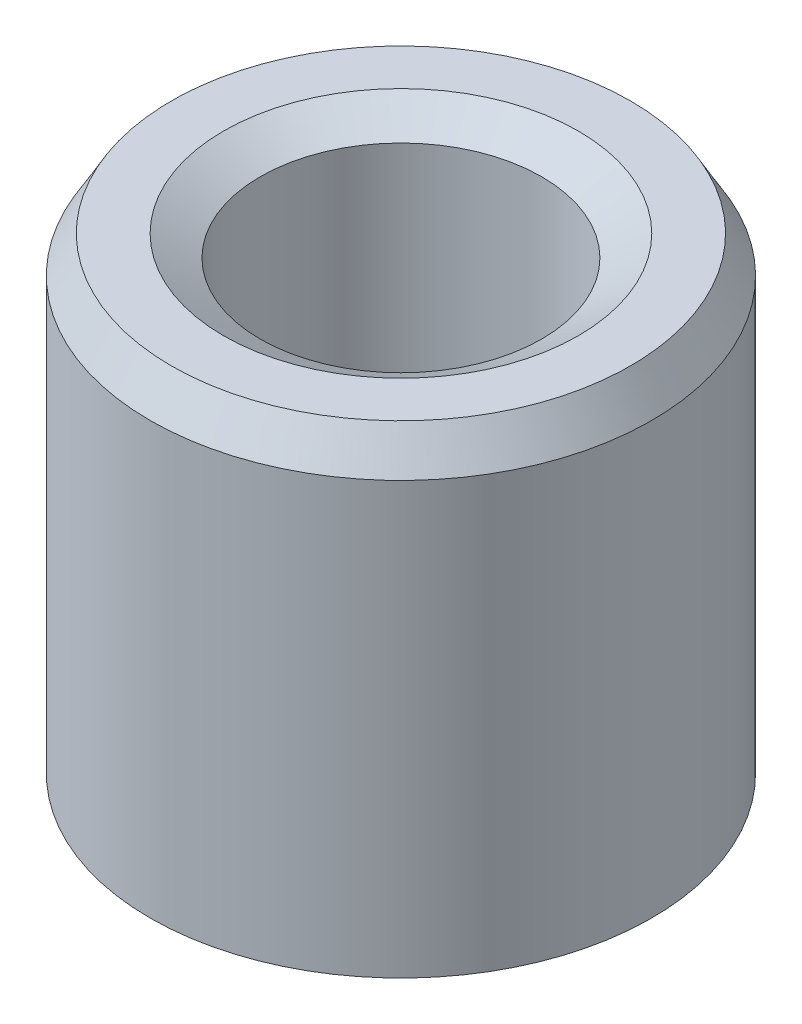
from build123d import *
from OCP.BRepFilletAPI import BRepFilletAPI_MakeChamfer

# Parameters (mm, degrees)
SKETCH1_R           = 5
BOSS_EXTRUDE1_DEPTH = 9.746797896
SKETCH2_R           = 2.80569337
CUT_EXTRUDE1_DEPTH  = 13.041597453
CHAMFER1_SIZE       = 0.731059209
CHAMFER1_SIZE2      = 0.4230348


with BuildPart() as part:
    # Sketch1 → Boss-Extrude1 (new body)
    with BuildSketch(Plane(origin=(0, 0, 0), x_dir=(1, 0, 0), z_dir=(0, 1, 0))):
        Circle(SKETCH1_R)
    extrude(amount=BOSS_EXTRUDE1_DEPTH)

    # Sketch2 → Cut-Extrude1 (cut, through all)
    with BuildSketch(Plane(origin=(0, 0, 0), x_dir=(1, 0, 0), z_dir=(0, 1, 0))):
        Circle(SKETCH2_R)
    extrude(amount=CUT_EXTRUDE1_DEPTH, mode=Mode.SUBTRACT)

    # Chamfer1: one chamfer whose edges measure the first distance from different faces: ONE call of the kernel's chamfer builder (chamfer() names one face for all edges)
    chamfer1_edges_1 = [part.edges().sort_by_distance(p)[0] for p in [
        (-2.80569337, 9.746797896, 0),
    ]]
    chamfer1_side_1 = [part.faces().sort_by_distance(p)[0] for p in [
        (-4.858578644, 9.746797896, 0),
    ]]
    chamfer1_edges_2 = [part.edges().sort_by_distance(p)[0] for p in [
        (-2.80569337, 0, 0),
    ]]
    chamfer1_side_2 = [part.faces().sort_by_distance(p)[0] for p in [
        (-2.80569337, 4.873398948, 0),
    ]]
    chamfer1_edges_3 = [part.edges().sort_by_distance(p)[0] for p in [
        (-5, 0, 0),
    ]]
    chamfer1_side_3 = [part.faces().sort_by_distance(p)[0] for p in [
        (-4.858578644, 0, 0),
    ]]
    chamfer1_edges_4 = [part.edges().sort_by_distance(p)[0] for p in [
        (-5, 9.746797896, 0),
    ]]
    chamfer1_side_4 = [part.faces().sort_by_distance(p)[0] for p in [
        (-5, 4.873398948, 0),
    ]]
    chamfer1 = BRepFilletAPI_MakeChamfer(part.part.solid().wrapped)
    for e in chamfer1_edges_1:
        chamfer1.Add(CHAMFER1_SIZE, CHAMFER1_SIZE2, e.wrapped, chamfer1_side_1[0].wrapped)  # the first distance lies on this face
    for e in chamfer1_edges_2:
        chamfer1.Add(CHAMFER1_SIZE, CHAMFER1_SIZE2, e.wrapped, chamfer1_side_2[0].wrapped)  # the first distance lies on this face
    for e in chamfer1_edges_3:
        chamfer1.Add(CHAMFER1_SIZE, CHAMFER1_SIZE2, e.wrapped, chamfer1_side_3[0].wrapped)  # the first distance lies on this face
    for e in chamfer1_edges_4:
        chamfer1.Add(CHAMFER1_SIZE, CHAMFER1_SIZE2, e.wrapped, chamfer1_side_4[0].wrapped)  # the first distance lies on this face
    add(Compound.cast(chamfer1.Shape()), mode=Mode.REPLACE)


solid = part.part
